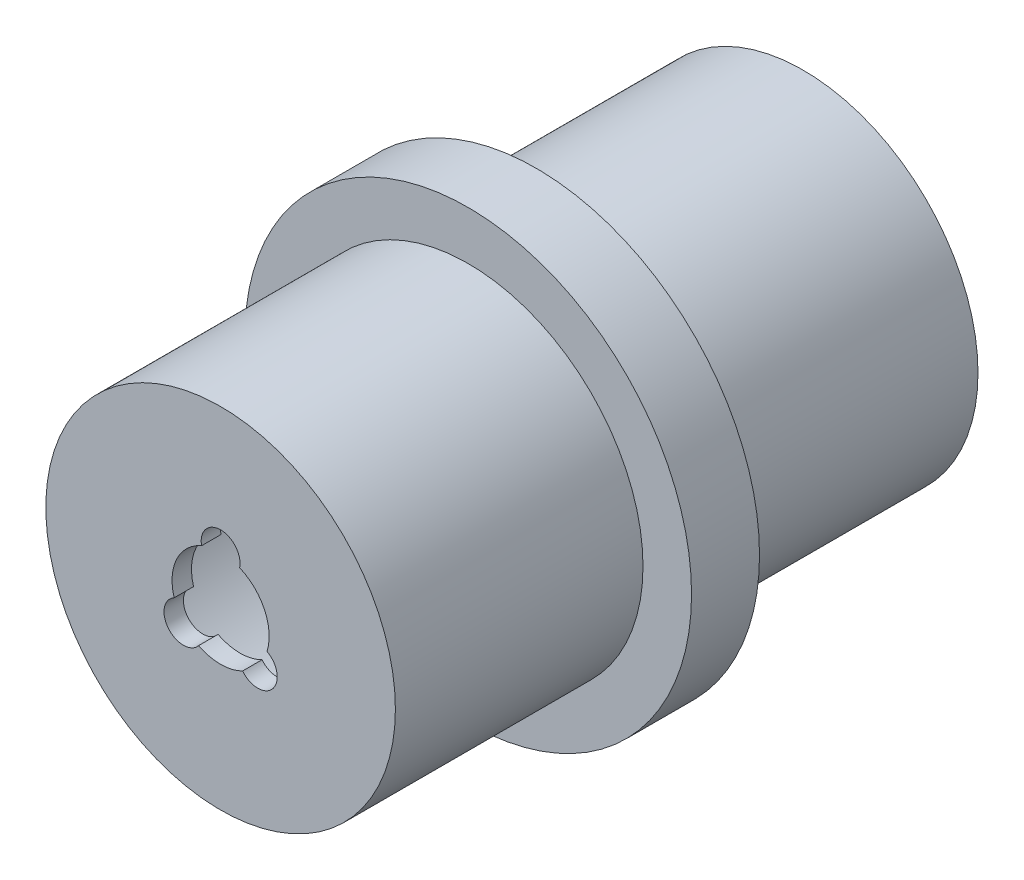
from build123d import *

# Parameters (mm, degrees)
CUT_EXTRUDE1_DEPTH = 2
CUT_EXTRUDE2_DEPTH = 1
CUT_EXTRUDE3_REACH = 70.25


with BuildPart() as part:
    # Sketch1 → Revolve1 (revolve)
    with BuildSketch(Plane(origin=(0, 0, 0), x_dir=(0, 0, -1), z_dir=(1, 0, 0))):
        Polygon((-60, 18), (-60, 5), (-58, 5), (-58, 17), (-2, 17), (-2, 13), (0, 13), (0, 18), (-27.5, 18), (-27.5, 23), (-34.5, 23), (-34.5, 18), align=None)
    revolve(axis=Axis((0, 0, 1072.381477522), (0, 0, -1)))

    # Sketch3 → Cut-Extrude1 (cut, symmetric)
    with BuildSketch(Plane.XY.offset(31)):
        with BuildLine():
            ThreePointArc((-6.498382723, 17.854159795), (0, -19), (6.498382723, 17.854159795))
            Line((6.498382723, 17.854159795), (7.524443153, 20.673237657))
            ThreePointArc((7.524443153, 20.673237657), (0, 22), (-7.524443153, 20.673237657))
            Line((-7.524443153, 20.673237657), (-6.498382723, 17.854159795))
        make_face()
        with BuildLine():
            add(Edge.make_bspline(
                [(-1, 19.972475891), (-1.837517439, 19.972475891), (-3.400702548, 17.606617047), (-4.505243001, 16.51810785)],
                knots=[0, 0, 0, 0, 1, 1, 1, 1], degree=3))
            Line((-1, 19.972475891), (1, 19.972475891))
            add(Edge.make_bspline(
                [(1, 19.972475891), (1.837517439, 19.972475891), (3.400702548, 17.606617047), (4.505243001, 16.51810785)],
                knots=[0, 0, 0, 0, 1, 1, 1, 1], degree=3))
            Line((4.505243001, 16.51810785), (4.683957663, 16.341987046))
            ThreePointArc((4.683957663, 16.341987046), (13.576215973, 10.231635249), (17, 0))
            ThreePointArc((17, 0), (-10.231635249, -13.576215973), (-4.683957663, 16.341987046))
            Line((-4.683957663, 16.341987046), (-4.505243001, 16.51810785))
        make_face(mode=Mode.SUBTRACT)
    extrude(amount=CUT_EXTRUDE1_DEPTH, both=True, mode=Mode.SUBTRACT)

    # Sketch3<5> → Cut-Extrude2 (cut, symmetric)
    with BuildSketch(Plane.XY.offset(31)):
        with BuildLine():
            Line((1, 19.972475891), (-1, 19.972475891))
            add(Edge.make_bspline(
                [(-1, 19.972475891), (-1.837517439, 19.972475891), (-3.400702548, 17.606617047), (-4.505243001, 16.51810785)],
                knots=[0, 0, 0, 0, 1, 1, 1, 1], degree=3))
            Line((-4.505243001, 16.51810785), (-4.683957663, 16.341987046))
            ThreePointArc((-4.683957663, 16.341987046), (0, -17), (4.683957663, 16.341987046))
            Line((4.683957663, 16.341987046), (4.505243001, 16.51810785))
            add(Edge.make_bspline(
                [(1, 19.972475891), (1.837517439, 19.972475891), (3.400702548, 17.606617047), (4.505243001, 16.51810785)],
                knots=[0, 0, 0, 0, 1, 1, 1, 1], degree=3))
        make_face()
        with BuildLine():
            Line((7.524443153, 20.673237657), (6.498382723, 17.854159795))
            ThreePointArc((6.498382723, 17.854159795), (0, -19), (-6.498382723, 17.854159795))
            Line((-6.498382723, 17.854159795), (-7.524443153, 20.673237657))
            ThreePointArc((-7.524443153, 20.673237657), (0, -22), (7.524443153, 20.673237657))
        make_face()
    extrude(amount=CUT_EXTRUDE2_DEPTH, both=True, mode=Mode.SUBTRACT)

    # Sketch5 → Cut-Extrude3 (cut, up to next)
    with BuildSketch(Plane.XY.offset(60), mode=Mode.PRIVATE) as cut_extrude3_sk1:
        with BuildLine():
            ThreePointArc((1.959591794, 4.6), (0, 7), (-1.959591794, 4.6))
            ThreePointArc((-1.959591794, 4.6), (0, 5), (1.959591794, 4.6))
        make_face()
    cut_extrude3_tool1 = extrude(cut_extrude3_sk1.sketch, amount=-CUT_EXTRUDE3_REACH, mode=Mode.PRIVATE) & part.part
    # Sketch5 → Cut-Extrude3 (cut, up to next)
    with BuildSketch(Plane.XY.offset(60), mode=Mode.PRIVATE) as cut_extrude3_sk2:
        with BuildLine():
            ThreePointArc((-2.264203113, -4.457957409), (-3.830222216, -3.213938048), (-4.783405764, -1.4556886))
            ThreePointArc((-4.783405764, -1.4556886), (-5.362311102, -4.499513268), (-2.264203113, -4.457957409))
        make_face()
    cut_extrude3_tool2 = extrude(cut_extrude3_sk2.sketch, amount=-CUT_EXTRUDE3_REACH, mode=Mode.PRIVATE) & part.part
    # Sketch5 → Cut-Extrude3 (cut, up to next)
    with BuildSketch(Plane.XY.offset(60), mode=Mode.PRIVATE) as cut_extrude3_sk3:
        with BuildLine():
            ThreePointArc((2.264203113, -4.457957409), (5.362311102, -4.499513268), (4.783405764, -1.4556886))
            ThreePointArc((4.783405764, -1.4556886), (3.830222216, -3.213938048), (2.264203113, -4.457957409))
        make_face()
    cut_extrude3_tool3 = extrude(cut_extrude3_sk3.sketch, amount=-CUT_EXTRUDE3_REACH, mode=Mode.PRIVATE) & part.part
    add(cut_extrude3_tool1.solids().sort_by_distance((0, 5.772711, 60))[0], mode=Mode.SUBTRACT)
    add(cut_extrude3_tool2.solids().sort_by_distance((-4.422153, -3.710627, 60))[0], mode=Mode.SUBTRACT)
    add(cut_extrude3_tool3.solids().sort_by_distance((4.422153, -3.710627, 60))[0], mode=Mode.SUBTRACT)


solid = part.part
